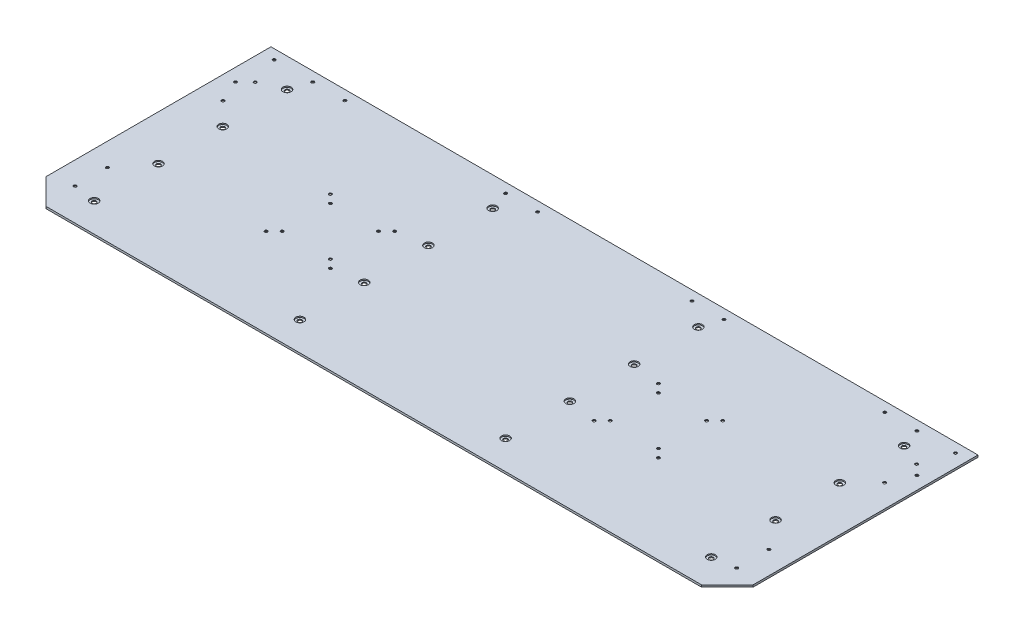
from build123d import *

# Parameters (mm, degrees)
SKETCH1_W                         = 1100
SKETCH1_H                         = 390
PLATE_DEPTH                       = 3.175
MONITOR_HOLES_AT_2_COUNT          = 2
MONITOR_HOLES_AT_2_PITCH          = 106.066017178
MONITOR_HOLES_AT_3_COUNT          = 2
MONITOR_HOLES_AT_3_PITCH          = 75
MONITOR_HOLES_AT_4_COUNT          = 2
MONITOR_HOLES_AT_4_PITCH          = 75
MONITOR_HOLES_AT_5_COUNT          = 2
MONITOR_HOLES_AT_5_PITCH          = 17.67766953
MONITOR_HOLES_AT_6_COUNT          = 2
MONITOR_HOLES_AT_6_PITCH          = 123.743686708
MONITOR_HOLES_AT_7_COUNT          = 2
MONITOR_HOLES_AT_7_PITCH          = 88.388347648
MONITOR_HOLES_AT_8_COUNT          = 2
MONITOR_HOLES_AT_8_PITCH          = 88.388347648
MONITOR_HOLES_AT_9_COUNT          = 2
MONITOR_HOLES_AT_9_PITCH          = 510.4
MONITOR_HOLES_AT_10_COUNT         = 2
MONITOR_HOLES_AT_10_PITCH         = 435.4
MONITOR_HOLES_AT_11_COUNT         = 2
MONITOR_HOLES_AT_11_PITCH         = 515.88095526
MONITOR_HOLES_AT_12_COUNT         = 2
MONITOR_HOLES_AT_12_PITCH         = 441.81235836
MONITOR_HOLES_AT_13_COUNT         = 2
MONITOR_HOLES_AT_13_PITCH         = 530.170406568
MONITOR_HOLES_AT_14_COUNT         = 2
MONITOR_HOLES_AT_14_PITCH         = 431.857221776
MONITOR_HOLES_AT_15_COUNT         = 2
MONITOR_HOLES_AT_15_PITCH         = 523.049385814
MONITOR_HOLES_AT_16_COUNT         = 2
MONITOR_HOLES_AT_16_PITCH         = 423.084696013
STRUT_HOLES_AT_2_COUNT            = 2
STRUT_HOLES_AT_2_PITCH            = 60
STRUT_HOLES_AT_3_COUNT            = 2
STRUT_HOLES_AT_3_PITCH            = 1060
STRUT_HOLES_AT_4_COUNT            = 2
STRUT_HOLES_AT_4_PITCH            = 1061.696755199
GLARE_PROTECTOR_HOLES_AT_2_COUNT  = 2
GLARE_PROTECTOR_HOLES_AT_2_PITCH  = 50
GLARE_PROTECTOR_HOLES_AT_3_COUNT  = 2
GLARE_PROTECTOR_HOLES_AT_3_PITCH  = 280
GLARE_PROTECTOR_HOLES_AT_4_COUNT  = 2
GLARE_PROTECTOR_HOLES_AT_4_PITCH  = 230
GLARE_PROTECTOR_HOLES_AT_5_COUNT  = 2
GLARE_PROTECTOR_HOLES_AT_5_PITCH  = 63.357398937
GLARE_PROTECTOR_HOLES_AT_6_COUNT  = 2
GLARE_PROTECTOR_HOLES_AT_6_PITCH  = 104.757625021
GLARE_PROTECTOR_HOLES_AT_7_COUNT  = 2
GLARE_PROTECTOR_HOLES_AT_7_PITCH  = 347.525768829
GLARE_PROTECTOR_HOLES_AT_8_COUNT  = 2
GLARE_PROTECTOR_HOLES_AT_8_PITCH  = 397.15760096
GLARE_PROTECTOR_HOLES_AT_9_COUNT  = 2
GLARE_PROTECTOR_HOLES_AT_9_PITCH  = 935.682724004
GLARE_PROTECTOR_HOLES_AT_10_COUNT = 2
GLARE_PROTECTOR_HOLES_AT_10_PITCH = 985.627799933
GLARE_PROTECTOR_HOLES_AT_11_COUNT = 2
GLARE_PROTECTOR_HOLES_AT_11_PITCH = 636.193492579
GLARE_PROTECTOR_HOLES_AT_12_COUNT = 2
GLARE_PROTECTOR_HOLES_AT_12_PITCH = 686.07737173
GLARE_PROTECTOR_HOLES_AT_13_COUNT = 2
GLARE_PROTECTOR_HOLES_AT_13_PITCH = 1029.2
GLARE_PROTECTOR_HOLES_AT_14_COUNT = 2
GLARE_PROTECTOR_HOLES_AT_14_PITCH = 1030.413819783
GLARE_PROTECTOR_HOLES_AT_15_COUNT = 2
GLARE_PROTECTOR_HOLES_AT_15_PITCH = 1066.60800672
GLARE_PROTECTOR_HOLES_AT_16_COUNT = 2
GLARE_PROTECTOR_HOLES_AT_16_PITCH = 1054.586478199
CHAMFER1_SIZE                     = 40
CARRIAGE_HOLES_D                  = 6.35
CARRIAGE_HOLES_CBORE_D            = 12.7
CARRIAGE_HOLES_CBORE_DEPTH        = 1.7875


with BuildPart() as part:
    # Sketch1 → Plate (new body)
    with BuildSketch(Plane(origin=(0, 0, 0), x_dir=(1, 0, 0), z_dir=(0, 1, 0))):
        Rectangle(SKETCH1_W, SKETCH1_H)
    extrude(amount=PLATE_DEPTH)

    # Sketch7 → Monitor Holes (revolve, cut)
    with BuildSketch(Plane(origin=(217.7, 0, -30.1), x_dir=(0, 0, -1), z_dir=(1, 0, 0))):
        Polygon((0, 0), (0, 3.175), (2.25, 3.175), (2.25, 2.23), (4.48, 0), align=None)
    monitor_holes = revolve(axis=Axis((217.7, -6.35, -30.1), (0, 1, 0)), mode=Mode.SUBTRACT)

    # Monitor Holes at 2: Monitor Holes ×2
    with Locations(*[Vector(0.7071067811865477, 0, 0.7071067811865474) * (i * MONITOR_HOLES_AT_2_PITCH) for i in range(1, MONITOR_HOLES_AT_2_COUNT)]):
        add(monitor_holes, mode=Mode.SUBTRACT)

    # Monitor Holes at 3: Monitor Holes ×2
    with Locations(*[(i * MONITOR_HOLES_AT_3_PITCH, 0, 0) for i in range(1, MONITOR_HOLES_AT_3_COUNT)]):
        add(monitor_holes, mode=Mode.SUBTRACT)

    # Monitor Holes at 4: Monitor Holes ×2
    with Locations(*[(0, 0, i * MONITOR_HOLES_AT_4_PITCH) for i in range(1, MONITOR_HOLES_AT_4_COUNT)]):
        add(monitor_holes, mode=Mode.SUBTRACT)

    # Monitor Holes at 5: Monitor Holes ×2
    with Locations(*[Vector(-0.7071067811865468, 0, -0.7071067811865483) * (i * MONITOR_HOLES_AT_5_PITCH) for i in range(1, MONITOR_HOLES_AT_5_COUNT)]):
        add(monitor_holes, mode=Mode.SUBTRACT)

    # Monitor Holes at 6: Monitor Holes ×2
    with Locations(*[Vector(0.7071067811865478, 0, 0.7071067811865474) * (i * MONITOR_HOLES_AT_6_PITCH) for i in range(1, MONITOR_HOLES_AT_6_COUNT)]):
        add(monitor_holes, mode=Mode.SUBTRACT)

    # Monitor Holes at 7: Monitor Holes ×2
    with Locations(*[Vector(0.9899494936611666, 0, -0.1414213562373094) * (i * MONITOR_HOLES_AT_7_PITCH) for i in range(1, MONITOR_HOLES_AT_7_COUNT)]):
        add(monitor_holes, mode=Mode.SUBTRACT)

    # Monitor Holes at 8: Monitor Holes ×2
    with Locations(*[Vector(-0.14142135623730914, 0, 0.9899494936611667) * (i * MONITOR_HOLES_AT_8_PITCH) for i in range(1, MONITOR_HOLES_AT_8_COUNT)]):
        add(monitor_holes, mode=Mode.SUBTRACT)

    # Monitor Holes at 9: Monitor Holes ×2
    with Locations(*[(-i * MONITOR_HOLES_AT_9_PITCH, 0, 0) for i in range(1, MONITOR_HOLES_AT_9_COUNT)]):
        add(monitor_holes, mode=Mode.SUBTRACT)

    # Monitor Holes at 10: Monitor Holes ×2
    with Locations(*[(-i * MONITOR_HOLES_AT_10_PITCH, 0, 0) for i in range(1, MONITOR_HOLES_AT_10_COUNT)]):
        add(monitor_holes, mode=Mode.SUBTRACT)

    # Monitor Holes at 11: Monitor Holes ×2
    with Locations(*[Vector(-0.989375542546892, 0, 0.14538237792127132) * (i * MONITOR_HOLES_AT_11_PITCH) for i in range(1, MONITOR_HOLES_AT_11_COUNT)]):
        add(monitor_holes, mode=Mode.SUBTRACT)

    # Monitor Holes at 12: Monitor Holes ×2
    with Locations(*[Vector(-0.9854862403934994, 0, 0.16975532390792936) * (i * MONITOR_HOLES_AT_12_PITCH) for i in range(1, MONITOR_HOLES_AT_12_COUNT)]):
        add(monitor_holes, mode=Mode.SUBTRACT)

    # Monitor Holes at 13: Monitor Holes ×2
    with Locations(*[Vector(-0.9862866608971649, 0, 0.16504127525052958) * (i * MONITOR_HOLES_AT_13_PITCH) for i in range(1, MONITOR_HOLES_AT_13_COUNT)]):
        add(monitor_holes, mode=Mode.SUBTRACT)

    # Monitor Holes at 14: Monitor Holes ×2
    with Locations(*[Vector(-0.9792588352718359, 0, 0.2026132610221935) * (i * MONITOR_HOLES_AT_14_PITCH) for i in range(1, MONITOR_HOLES_AT_14_COUNT)]):
        add(monitor_holes, mode=Mode.SUBTRACT)

    # Monitor Holes at 15: Monitor Holes ×2
    with Locations(*[Vector(-0.9997143944383325, 0, -0.023898316944882675) * (i * MONITOR_HOLES_AT_15_PITCH) for i in range(1, MONITOR_HOLES_AT_15_COUNT)]):
        add(monitor_holes, mode=Mode.SUBTRACT)

    # Monitor Holes at 16: Monitor Holes ×2
    with Locations(*[Vector(-0.9995634538090055, 0, -0.029544911734718758) * (i * MONITOR_HOLES_AT_16_PITCH) for i in range(1, MONITOR_HOLES_AT_16_COUNT)]):
        add(monitor_holes, mode=Mode.SUBTRACT)

    # Sketch12 → Strut Holes (revolve, cut)
    with BuildSketch(Plane(origin=(-530, 3.175, -180), x_dir=(0, 0, 1), z_dir=(1, 0, 0))):
        Polygon((0, 0), (0, 3.175), (4.48, 3.175), (2.25, 0.945), (2.25, 0), align=None)
    strut_holes = revolve(axis=Axis((-530, 9.525, -180), (0, -1, 0)), mode=Mode.SUBTRACT)

    # Strut Holes at 2: Strut Holes ×2
    with Locations(*[(0, 0, i * STRUT_HOLES_AT_2_PITCH) for i in range(1, STRUT_HOLES_AT_2_COUNT)]):
        add(strut_holes, mode=Mode.SUBTRACT)

    # Strut Holes at 3: Strut Holes ×2
    with Locations(*[(i * STRUT_HOLES_AT_3_PITCH, 0, 0) for i in range(1, STRUT_HOLES_AT_3_COUNT)]):
        add(strut_holes, mode=Mode.SUBTRACT)

    # Strut Holes at 4: Strut Holes ×2
    with Locations(*[Vector(0.9984018457335854, 0, 0.056513312022655166) * (i * STRUT_HOLES_AT_4_PITCH) for i in range(1, STRUT_HOLES_AT_4_COUNT)]):
        add(strut_holes, mode=Mode.SUBTRACT)

    # Sketch16 → Glare Protector Holes (revolve, cut)
    with BuildSketch(Plane(origin=(-514.6, 3.175, -135), x_dir=(0, 0, 1), z_dir=(1, 0, 0))):
        Polygon((0, 0), (0, 3.175), (4.48, 3.175), (2.25, 0.945), (2.25, 0), align=None)
    glare_protector_holes = revolve(axis=Axis((-514.6, 9.525, -135), (0, -1, 0)), mode=Mode.SUBTRACT)

    # Glare Protector Holes at 2: Glare Protector Holes ×2
    with Locations(*[(0, 0, i * GLARE_PROTECTOR_HOLES_AT_2_PITCH) for i in range(1, GLARE_PROTECTOR_HOLES_AT_2_COUNT)]):
        add(glare_protector_holes, mode=Mode.SUBTRACT)

    # Glare Protector Holes at 3: Glare Protector Holes ×2
    with Locations(*[(0, 0, i * GLARE_PROTECTOR_HOLES_AT_3_PITCH) for i in range(1, GLARE_PROTECTOR_HOLES_AT_3_COUNT)]):
        add(glare_protector_holes, mode=Mode.SUBTRACT)

    # Glare Protector Holes at 4: Glare Protector Holes ×2
    with Locations(*[(0, 0, i * GLARE_PROTECTOR_HOLES_AT_4_PITCH) for i in range(1, GLARE_PROTECTOR_HOLES_AT_4_COUNT)]):
        add(glare_protector_holes, mode=Mode.SUBTRACT)

    # Glare Protector Holes at 5: Glare Protector Holes ×2
    with Locations(*[Vector(0.7039430397812528, 0, -0.7102564302725669) * (i * GLARE_PROTECTOR_HOLES_AT_5_PITCH) for i in range(1, GLARE_PROTECTOR_HOLES_AT_5_COUNT)]):
        add(glare_protector_holes, mode=Mode.SUBTRACT)

    # Glare Protector Holes at 6: Glare Protector Holes ×2
    with Locations(*[Vector(0.903036890929997, 0, -0.4295630030850944) * (i * GLARE_PROTECTOR_HOLES_AT_6_PITCH) for i in range(1, GLARE_PROTECTOR_HOLES_AT_6_COUNT)]):
        add(glare_protector_holes, mode=Mode.SUBTRACT)

    # Glare Protector Holes at 7: Glare Protector Holes ×2
    with Locations(*[Vector(0.991581145655498, 0, -0.12948680079656827) * (i * GLARE_PROTECTOR_HOLES_AT_7_PITCH) for i in range(1, GLARE_PROTECTOR_HOLES_AT_7_COUNT)]):
        add(glare_protector_holes, mode=Mode.SUBTRACT)

    # Glare Protector Holes at 8: Glare Protector Holes ×2
    with Locations(*[Vector(0.9935602366580941, 0, -0.11330514609633617) * (i * GLARE_PROTECTOR_HOLES_AT_8_PITCH) for i in range(1, GLARE_PROTECTOR_HOLES_AT_8_COUNT)]):
        add(glare_protector_holes, mode=Mode.SUBTRACT)

    # Glare Protector Holes at 9: Glare Protector Holes ×2
    with Locations(*[Vector(0.9988428513464379, 0, -0.04809322524137568) * (i * GLARE_PROTECTOR_HOLES_AT_9_PITCH) for i in range(1, GLARE_PROTECTOR_HOLES_AT_9_COUNT)]):
        add(glare_protector_holes, mode=Mode.SUBTRACT)

    # Glare Protector Holes at 10: Glare Protector Holes ×2
    with Locations(*[Vector(0.9989572129228886, 0, -0.045656179749674994) * (i * GLARE_PROTECTOR_HOLES_AT_10_PITCH) for i in range(1, GLARE_PROTECTOR_HOLES_AT_10_COUNT)]):
        add(glare_protector_holes, mode=Mode.SUBTRACT)

    # Glare Protector Holes at 11: Glare Protector Holes ×2
    with Locations(*[Vector(0.9974952705463157, 0, -0.07073319756474034) * (i * GLARE_PROTECTOR_HOLES_AT_11_PITCH) for i in range(1, GLARE_PROTECTOR_HOLES_AT_11_COUNT)]):
        add(glare_protector_holes, mode=Mode.SUBTRACT)

    # Glare Protector Holes at 12: Glare Protector Holes ×2
    with Locations(*[Vector(0.9978466397655488, 0, -0.06559026992323941) * (i * GLARE_PROTECTOR_HOLES_AT_12_PITCH) for i in range(1, GLARE_PROTECTOR_HOLES_AT_12_COUNT)]):
        add(glare_protector_holes, mode=Mode.SUBTRACT)

    # Glare Protector Holes at 13: Glare Protector Holes ×2
    with Locations(*[(i * GLARE_PROTECTOR_HOLES_AT_13_PITCH, 0, 0) for i in range(1, GLARE_PROTECTOR_HOLES_AT_13_COUNT)]):
        add(glare_protector_holes, mode=Mode.SUBTRACT)

    # Glare Protector Holes at 14: Glare Protector Holes ×2
    with Locations(*[Vector(0.9988220074694302, 0, 0.04852419391126265) * (i * GLARE_PROTECTOR_HOLES_AT_14_PITCH) for i in range(1, GLARE_PROTECTOR_HOLES_AT_14_COUNT)]):
        add(glare_protector_holes, mode=Mode.SUBTRACT)

    # Glare Protector Holes at 15: Glare Protector Holes ×2
    with Locations(*[Vector(0.9649280649641919, 0, 0.26251443664008334) * (i * GLARE_PROTECTOR_HOLES_AT_15_PITCH) for i in range(1, GLARE_PROTECTOR_HOLES_AT_15_COUNT)]):
        add(glare_protector_holes, mode=Mode.SUBTRACT)

    # Glare Protector Holes at 16: Glare Protector Holes ×2
    with Locations(*[Vector(0.975927551961148, 0, 0.21809496400219983) * (i * GLARE_PROTECTOR_HOLES_AT_16_PITCH) for i in range(1, GLARE_PROTECTOR_HOLES_AT_16_COUNT)]):
        add(glare_protector_holes, mode=Mode.SUBTRACT)

    # Chamfer1
    chamfer1_edges = [part.edges().sort_by_distance(p)[0] for p in [
        (550, 1.5875, 195),
        (-550, 1.5875, 195),
    ]]
    chamfer(chamfer1_edges, length=CHAMFER1_SIZE)

    # Carriage Holes (through all)
    with Locations(Plane(origin=(0, 3.175, 0), x_dir=(1, 0, 0), z_dir=(0, 1, 0))):
        with Locations((160, -150), (480, -150), (160, -50), (480, -50), (160, 50), (480, 50), (160, 150), (480, 150)):
            carriage_holes = CounterBoreHole(CARRIAGE_HOLES_D / 2, CARRIAGE_HOLES_CBORE_D / 2, CARRIAGE_HOLES_CBORE_DEPTH)

    # Mirror1: Carriage Holes across plane
    add(carriage_holes.mirror(Plane(origin=(0, 0, 0), x_dir=(0, 0, 1), z_dir=(1, 0, 0))), mode=Mode.SUBTRACT)


solid = part.part
